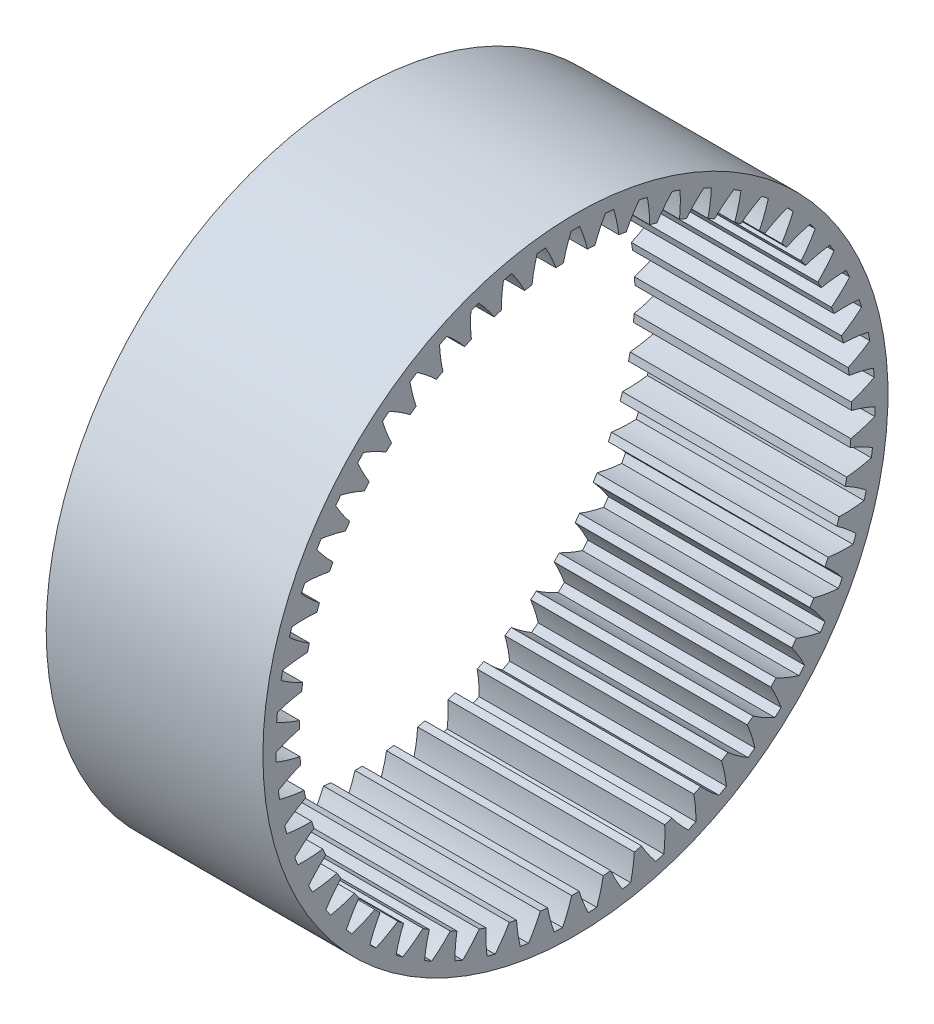
from build123d import *

# Parameters (mm, degrees)
BASPROSKE_W     = 26
BASPROSKE_H     = 4.375
TOOTHCUT_DEPTH  = 60.063525123
TEETHCUTS_COUNT = 55
TEETHCUTS_ANGLE = 353.454545455


with BuildPart() as part:
    # BasProSke → Base-Revolve (revolve)
    with BuildSketch(Plane(origin=(0, 0, 0), x_dir=(1, 0, 0), z_dir=(0, 1, 0))):
        with Locations((13, 35.3125)):
            Rectangle(BASPROSKE_W, BASPROSKE_H)
    revolve(axis=Axis((-10, 0, 0), (1, 0, 0)))

    # TooCutSke → ToothCut (cut, through all)
    with BuildSketch(Plane(origin=(0, 0, 0), x_dir=(0, 0, -1), z_dir=(1, 0, 0))):
        with BuildLine():
            ThreePointArc((1.451447951, 33.067761022), (1.040603726, 34.522224287), (0.503573985, 35.934971761))
            ThreePointArc((0.503573985, 35.934971761), (0, 35.9385), (-0.503573985, 35.934971761))
            ThreePointArc((-0.503573985, 35.934971761), (-1.040603726, 34.522224287), (-1.451447951, 33.067761022))
            ThreePointArc((-1.451447951, 33.067761022), (0, 33.0996), (1.451447951, 33.067761022))
        make_face()
    toothcut = extrude(amount=TOOTHCUT_DEPTH, mode=Mode.SUBTRACT)

    # TeethCuts: ToothCut ×55 about axis
    teethcuts_axis = Axis((-10, 0, 0), (1, 0, 0))
    for i in range(1, TEETHCUTS_COUNT):
        add(toothcut.rotate(teethcuts_axis, i * TEETHCUTS_ANGLE / (TEETHCUTS_COUNT - 1)), mode=Mode.SUBTRACT)


solid = part.part
